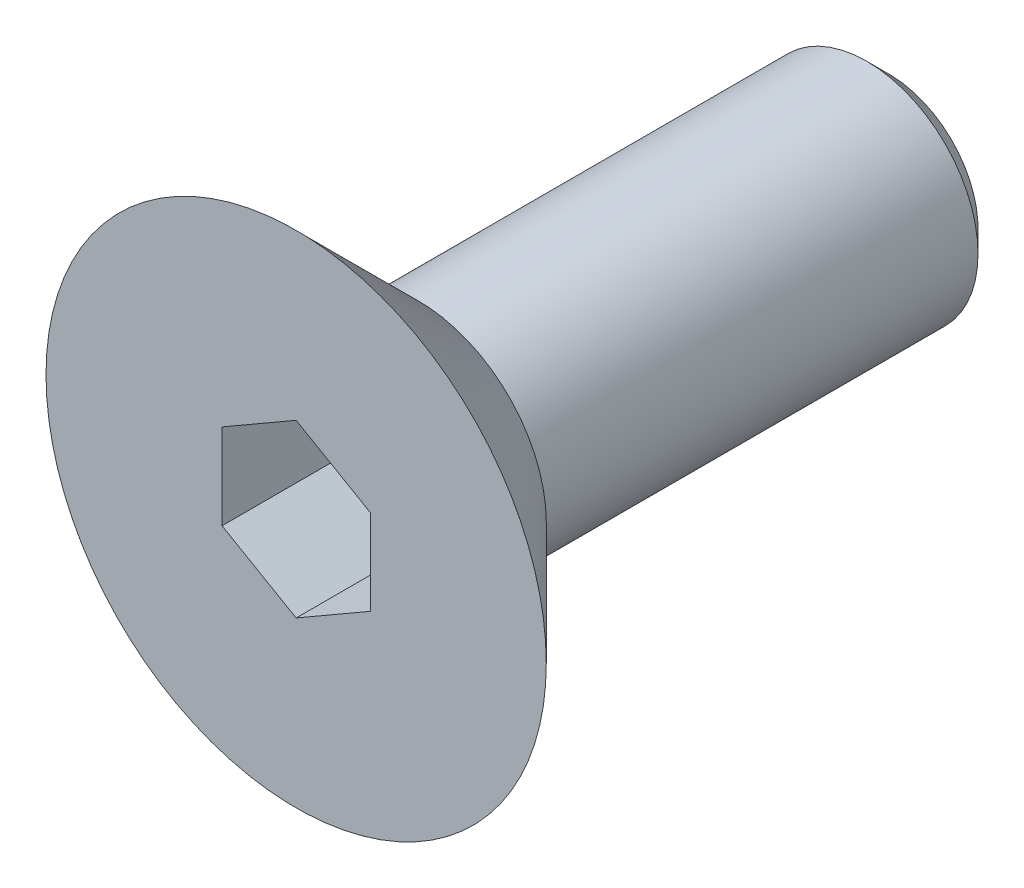
from build123d import *

# Parameters (mm, degrees)
SKETCH1_R           = 3.375
BOSS_EXTRUDE1_DEPTH = 1.65
SKETCH2_R           = 1.5
BOSS_EXTRUDE2_DEPTH = 6.35
CHAMFER1_SIZE       = 0.3
CUT_EXTRUDE1_DEPTH  = 2
CHAMFER2_SIZE       = 1.65


with BuildPart() as part:
    # Sketch1 → Boss-Extrude1 (new body)
    with BuildSketch(Plane.XY):
        Circle(SKETCH1_R)
    extrude(amount=BOSS_EXTRUDE1_DEPTH)

    # Sketch2 → Boss-Extrude2 (add)
    with BuildSketch(Plane(origin=(0, 0, 0), x_dir=(-1, 0, 0), z_dir=(0, 0, -1))):
        with Locations(Location((0, 0, 0), (0, 0, 180))):
            Circle(SKETCH2_R)
    extrude(amount=BOSS_EXTRUDE2_DEPTH)

    # Chamfer1
    chamfer1_edges = [part.edges().sort_by_distance(p)[0] for p in [
        (-1.5, 0, -6.35),
    ]]
    chamfer(chamfer1_edges, length=CHAMFER1_SIZE)

    # Sketch3 → Cut-Extrude1 (cut)
    with BuildSketch(Plane.XY.offset(1.65)):
        Polygon((0, 1.154700538), (-1, 0.577350269), (-1, -0.577350269), (0, -1.154700538), (1, -0.577350269), (1, 0.577350269), align=None)
    extrude(amount=-CUT_EXTRUDE1_DEPTH, mode=Mode.SUBTRACT)

    # Chamfer2
    chamfer2_edges = [part.edges().sort_by_distance(p)[0] for p in [
        (-3.375, 0, 0),
    ]]
    chamfer(chamfer2_edges, length=CHAMFER2_SIZE - 0.0001)  # a hair under: the kernel refuses the full size


solid = part.part
